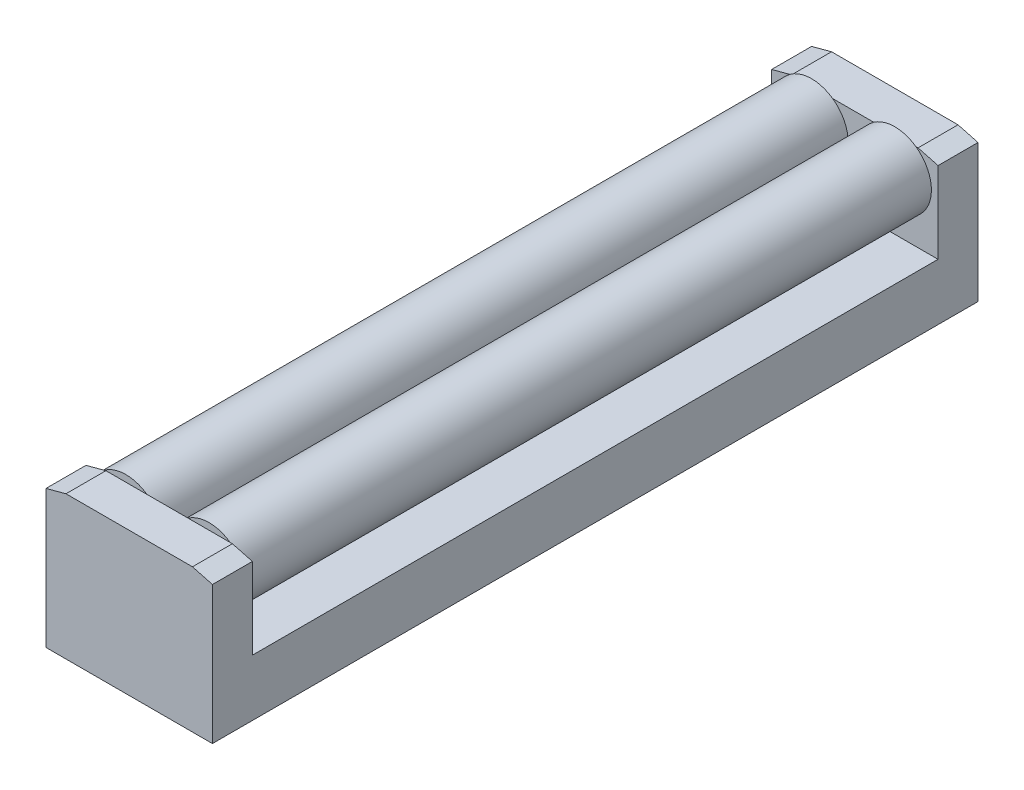
from build123d import *

# Parameters (mm, degrees)
SCHIZZO1_W               = 25
SCHIZZO1_H               = 21.5
ESTRUSIONE1_DEPTH        = 115
SCHIZZO6_W               = 103
SCHIZZO6_H               = 23.639461627
TAGLIO_ESTRUSIONE4_DEPTH = 84
SCHIZZO7_R               = 5.5
ESTRUSIONE4_DEPTH        = 103
SMUSSO1_SIZE             = 0.803847577
SMUSSO1_SIZE_2           = 3
SCHIZZO8_R               = 3
TAGLIO_ESTRUSIONE5_DEPTH = 8.5


with BuildPart() as part:
    # Schizzo1 → Estrusione1 (new body)
    with BuildSketch(Plane.XY):
        with Locations((12.5, 10.75)):
            Rectangle(SCHIZZO1_W, SCHIZZO1_H)
    extrude(amount=ESTRUSIONE1_DEPTH)

    # Schizzo6 → Taglio-Estrusione4 (cut)
    with BuildSketch(Plane(origin=(25, 0, 0), x_dir=(0, 0, -1), z_dir=(1, 0, 0))):
        with Locations((-57.5, 20.319730814)):
            Rectangle(SCHIZZO6_W, SCHIZZO6_H)
    extrude(amount=-TAGLIO_ESTRUSIONE4_DEPTH, mode=Mode.SUBTRACT)

    # Schizzo7 → Estrusione4 (add)
    with BuildSketch(Plane.XY.offset(6)):
        with Locations(Location((6, 17, 0), (0, 0, 125.096801228))):
            Circle(SCHIZZO7_R)
        with Locations(Location((18.5, 17, 0), (0, 0, 125.096801228))):
            Circle(SCHIZZO7_R)
    extrude(amount=ESTRUSIONE4_DEPTH)

    # Smusso1
    # the kernel refuses this chamfer: 3, 0.803847577 mm, written as the material it takes off along each edge
    with BuildSketch(Plane(origin=(0, 21.5, -7.790164711), x_dir=(-0.13751244702128895, -0.9905000388259545, 0), z_dir=(0, 0, 1)), Plane(origin=(0, 21.5, 109), x_dir=(-0.13751244702128895, -0.9905000388259545, 0), z_dir=(0, 0, 1))) as smusso1_piece_1:
        Polygon((SMUSSO1_SIZE * 0.990500039187, SMUSSO1_SIZE * 0.137512447071), (-SMUSSO1_SIZE_2 * 0.137512447021, SMUSSO1_SIZE_2 * 0.990500038826), (0, 0), align=None)
    extrude(amount=13.790164711, mode=Mode.SUBTRACT)
    with BuildSketch(Plane(origin=(25, 21.5, -7.790164711), x_dir=(0.13751244702128734, -0.9905000388259546, 0), z_dir=(0, 0, 1)), Plane(origin=(25, 21.5, 101.209835289), x_dir=(0.13751244702128734, -0.9905000388259546, 0), z_dir=(0, 0, 1))) as smusso1_piece_2:
        Polygon((SMUSSO1_SIZE * 0.990500039187, -SMUSSO1_SIZE * 0.137512447071), (-SMUSSO1_SIZE_2 * 0.137512447021, -SMUSSO1_SIZE_2 * 0.990500038826), (0, 0), align=None)
    extrude(amount=21.580329421, mode=Mode.SUBTRACT)

    # Schizzo8 → Taglio-Estrusione5 (cut)
    with BuildSketch(Plane.XZ):
        with Locations(Location((12, 105.5, 0), (0, 0, 270))):
            Circle(SCHIZZO8_R)
        with Locations(Location((12, 9.5, 0), (0, 0, 270))):
            Circle(SCHIZZO8_R)
    extrude(amount=-TAGLIO_ESTRUSIONE5_DEPTH, mode=Mode.SUBTRACT)


solid = part.part
